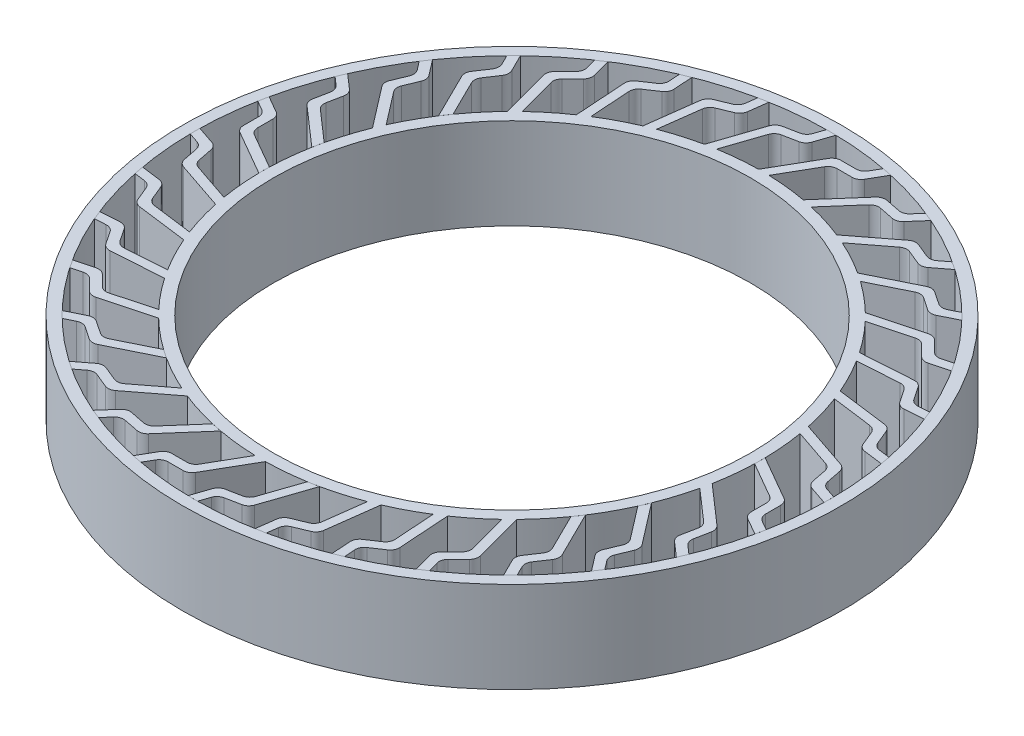
from build123d import *

# Parameters (mm, degrees)
CROQUIS1_R                 = 209.5
SALIENTE_EXTRUIR1_DEPTH    = 80
SALIENTE_EXTRUIR1_2_DEPTH  = 80
SALIENTE_EXTRUIR1_3_DEPTH  = 80
SALIENTE_EXTRUIR1_4_DEPTH  = 80
SALIENTE_EXTRUIR1_5_DEPTH  = 80
SALIENTE_EXTRUIR1_6_DEPTH  = 80
SALIENTE_EXTRUIR1_7_DEPTH  = 80
SALIENTE_EXTRUIR1_8_DEPTH  = 80
SALIENTE_EXTRUIR1_9_DEPTH  = 80
SALIENTE_EXTRUIR1_10_DEPTH = 80
CROQUIS1_R_2               = 289.5
SALIENTE_EXTRUIR1_11_DEPTH = 80


with BuildPart() as part:
    # Croquis1 → Saliente-Extruir1 (new body)
    with BuildSketch(Plane(origin=(0, 0, 0), x_dir=(1, 0, 0), z_dir=(0, 1, 0))):
        with BuildLine():
            Line((19.562792494, 258.450513392), (-2.896488779, 219.480888354))
            ThreePointArc((-2.896488779, 219.480888354), (-19.822178612, 218.60313638), (-36.629689119, 216.422078067))
            Line((-36.629689119, 216.422078067), (-25.139505567, 250.356570456))
            ThreePointArc((-25.139505567, 250.356570456), (-22.839167243, 253.803561656), (-19.122816641, 255.637149107))
            Line((-19.122816641, 255.637149107), (-6.167887823, 258.214044667))
            ThreePointArc((-6.167887823, 258.214044667), (-2.45153722, 260.047632118), (-0.151198896, 263.494623319))
            Line((-0.151198896, 263.494623319), (5.251498634, 279.450660694))
            Line((5.251498634, 279.450660694), (-3.184092463, 279.481862659))
            Line((-3.184092463, 279.481862659), (-6.245988291, 270.439023597))
            ThreePointArc((-6.245988291, 270.439023597), (-8.546326614, 266.992032397), (-12.262677217, 265.158444946))
            Line((-12.262677217, 265.158444946), (-25.217606035, 262.581549386))
            ThreePointArc((-25.217606035, 262.581549386), (-28.933956637, 260.747961935), (-31.234294961, 257.300970734))
            Line((-31.234294961, 257.300970734), (-45.659430745, 214.698547699))
            ThreePointArc((-45.659430745, 214.698547699), (-62.088657278, 210.535623203), (-78.147712816, 205.117490677))
            Line((-78.147712816, 205.117490677), (-73.498600966, 240.641564919))
            ThreePointArc((-73.498600966, 240.641564919), (-71.914937621, 244.471096894), (-68.627710819, 246.994476512))
            Line((-68.627710819, 246.994476512), (-56.424434711, 252.049238982))
            ThreePointArc((-56.424434711, 252.049238982), (-53.137207909, 254.572618599), (-51.553544565, 258.402150575))
            Line((-51.553544565, 258.402150575), (-49.367526822, 275.105611167))
            Line((-49.367526822, 275.105611167), (-57.647117603, 273.490511411))
            Line((-57.647117603, 273.490511411), (-58.886009576, 264.024081724))
            ThreePointArc((-58.886009576, 264.024081724), (-60.469672921, 260.194549748), (-63.756899722, 257.671170131))
            Line((-63.756899722, 257.671170131), (-75.960175831, 252.616407661))
            ThreePointArc((-75.960175831, 252.616407661), (-79.247402632, 250.093028043), (-80.831065977, 246.263496068))
            Line((-80.831065977, 246.263496068), (-86.667706393, 201.66546226))
            ThreePointArc((-86.667706393, 201.66546226), (-101.969103665, 194.377344096), (-116.662563734, 185.930353151))
            Line((-116.662563734, 185.930353151), (-119.033186348, 221.678838996))
            ThreePointArc((-119.033186348, 221.678838996), (-118.227057276, 225.74374498), (-115.495280558, 228.859944701))
            Line((-115.495280558, 228.859944701), (-104.512622216, 236.198322393))
            ThreePointArc((-104.512622216, 236.198322393), (-101.780845498, 239.314522114), (-100.974716427, 243.379428098))
            Line((-100.974716427, 243.379428098), (-102.089385908, 260.188407284))
            Line((-102.089385908, 260.188407284), (-109.894796342, 256.989073186))
            Line((-109.894796342, 256.989073186), (-109.263074538, 247.462842456))
            ThreePointArc((-109.263074538, 247.462842456), (-110.069203609, 243.397936472), (-112.800980327, 240.281736751))
            Line((-112.800980327, 240.281736751), (-123.783638669, 232.943359059))
            ThreePointArc((-123.783638669, 232.943359059), (-126.515415387, 229.827159338), (-127.321544458, 225.762253354))
            Line((-127.321544458, 225.762253354), (-124.345390689, 180.882486202))
            ThreePointArc((-124.345390689, 180.882486202), (-137.930934583, 170.749252664), (-150.694137753, 159.598016425))
            Line((-150.694137753, 159.598016425), (-159.993393133, 194.197119609))
            ThreePointArc((-159.993393133, 194.197119609), (-159.995777423, 198.341187544), (-157.924431436, 201.930453561))
            Line((-157.924431436, 201.930453561), (-148.584448261, 211.270436736))
            ThreePointArc((-148.584448261, 211.270436736), (-146.513102274, 214.859702753), (-146.515486564, 219.003770688))
            Line((-146.515486564, 219.003770688), (-150.888007146, 235.272308824))
            Line((-150.888007146, 235.272308824), (-157.919279688, 230.611688999))
            Line((-157.919279688, 230.611688999), (-155.44122082, 221.391744932))
            ThreePointArc((-155.44122082, 221.391744932), (-155.43883653, 217.247676996), (-157.510182517, 213.658410979))
            Line((-157.510182517, 213.658410979), (-166.850165692, 204.318427805))
            ThreePointArc((-166.850165692, 204.318427805), (-168.921511679, 200.729161788), (-168.919127389, 196.585093852))
            Line((-168.919127389, 196.585093852), (-157.244551354, 153.148297639))
            ThreePointArc((-157.244551354, 153.148297639), (-168.592157037, 140.559363209), (-178.934620569, 127.132417431))
            Line((-178.934620569, 127.132417431), (-184.100892094, 119.528705884))
            ThreePointArc((-184.100892094, 119.528705884), (-192.774477444, 104.967856252), (-200.298746264, 89.781190932))
            Line((-200.298746264, 89.781190932), (-222.13064154, 118.187923239))
            ThreePointArc((-222.13064154, 118.187923239), (-223.718710478, 122.015630358), (-223.178588955, 126.12434956))
            Line((-223.178588955, 126.12434956), (-218.123826486, 138.327625668))
            ThreePointArc((-218.123826486, 138.327625668), (-217.583704962, 142.43634487), (-219.171773901, 146.264051989))
            Line((-219.171773901, 146.264051989), (-229.437156185, 159.620930212))
            Line((-229.437156185, 159.620930212), (-234.149662982, 152.624327436))
            Line((-234.149662982, 152.624327436), (-228.331915272, 145.054521895))
            ThreePointArc((-228.331915272, 145.054521895), (-226.743846333, 141.226814776), (-227.283967857, 137.118095574))
            Line((-227.283967857, 137.118095574), (-232.338730326, 124.914819466))
            ThreePointArc((-232.338730326, 124.914819466), (-232.87885185, 120.806100264), (-231.290782911, 116.978393145))
            Line((-231.290782911, 116.978393145), (-203.882338796, 81.315692995))
            ThreePointArc((-203.882338796, 81.315692995), (-209.548582792, 65.342493446), (-213.965503469, 48.979723615))
            Line((-213.965503469, 48.979723615), (-215.828701556, 39.977763626))
            ThreePointArc((-215.828701556, 39.977763626), (-218.26985362, 23.206055262), (-219.409686368, 6.295992987))
            Line((-219.409686368, 6.295992987), (-219.480888354, -2.896488779))
            ThreePointArc((-219.480888354, -2.896488779), (-218.60313638, -19.822178612), (-216.422078067, -36.629689119))
            Line((-216.422078067, -36.629689119), (-250.356570456, -25.139505567))
            ThreePointArc((-250.356570456, -25.139505567), (-253.803561656, -22.839167243), (-255.637149107, -19.122816641))
            Line((-255.637149107, -19.122816641), (-258.214044667, -6.167887823))
            ThreePointArc((-258.214044667, -6.167887823), (-260.047632118, -2.45153722), (-263.494623319, -0.151198896))
            Line((-263.494623319, -0.151198896), (-279.450660694, 5.251498634))
            Line((-279.450660694, 5.251498634), (-279.481862659, -3.184092463))
            Line((-279.481862659, -3.184092463), (-270.439023597, -6.245988291))
            ThreePointArc((-270.439023597, -6.245988291), (-266.992032397, -8.546326614), (-265.158444946, -12.262677217))
            Line((-265.158444946, -12.262677217), (-262.581549386, -25.217606035))
            ThreePointArc((-262.581549386, -25.217606035), (-260.747961935, -28.933956637), (-257.300970734, -31.234294961))
            Line((-257.300970734, -31.234294961), (-214.698547699, -45.659430745))
            ThreePointArc((-214.698547699, -45.659430745), (-210.535623203, -62.088657278), (-205.117490677, -78.147712816))
            Line((-205.117490677, -78.147712816), (-240.641564919, -73.498600966))
            ThreePointArc((-240.641564919, -73.498600966), (-244.471096894, -71.914937621), (-246.994476512, -68.627710819))
            Line((-246.994476512, -68.627710819), (-252.049238982, -56.424434711))
            ThreePointArc((-252.049238982, -56.424434711), (-254.572618599, -53.137207909), (-258.402150575, -51.553544565))
            Line((-258.402150575, -51.553544565), (-275.105611167, -49.367526822))
            Line((-275.105611167, -49.367526822), (-273.490511411, -57.647117603))
            Line((-273.490511411, -57.647117603), (-264.024081724, -58.886009576))
            ThreePointArc((-264.024081724, -58.886009576), (-260.194549748, -60.469672921), (-257.671170131, -63.756899722))
            Line((-257.671170131, -63.756899722), (-252.616407661, -75.960175831))
            ThreePointArc((-252.616407661, -75.960175831), (-250.093028043, -79.247402632), (-246.263496068, -80.831065977))
            Line((-246.263496068, -80.831065977), (-201.66546226, -86.667706393))
            ThreePointArc((-201.66546226, -86.667706393), (-194.377344096, -101.969103665), (-185.930353151, -116.662563734))
            Line((-185.930353151, -116.662563734), (-221.678838996, -119.033186348))
            ThreePointArc((-221.678838996, -119.033186348), (-225.74374498, -118.227057276), (-228.859944701, -115.495280558))
            Line((-228.859944701, -115.495280558), (-236.198322393, -104.512622216))
            ThreePointArc((-236.198322393, -104.512622216), (-239.314522114, -101.780845498), (-243.379428098, -100.974716427))
            Line((-243.379428098, -100.974716427), (-260.188407284, -102.089385908))
            Line((-260.188407284, -102.089385908), (-256.989073186, -109.894796342))
            Line((-256.989073186, -109.894796342), (-247.462842456, -109.263074538))
            ThreePointArc((-247.462842456, -109.263074538), (-243.397936472, -110.069203609), (-240.281736751, -112.800980327))
            Line((-240.281736751, -112.800980327), (-232.943359059, -123.783638669))
            ThreePointArc((-232.943359059, -123.783638669), (-229.827159338, -126.515415387), (-225.762253354, -127.321544458))
            Line((-225.762253354, -127.321544458), (-180.882486202, -124.345390689))
            ThreePointArc((-180.882486202, -124.345390689), (-170.749252664, -137.930934583), (-159.598016425, -150.694137753))
            Line((-159.598016425, -150.694137753), (-194.197119609, -159.993393133))
            ThreePointArc((-194.197119609, -159.993393133), (-198.341187544, -159.995777423), (-201.930453561, -157.924431436))
            Line((-201.930453561, -157.924431436), (-211.270436736, -148.584448261))
            ThreePointArc((-211.270436736, -148.584448261), (-214.859702753, -146.513102274), (-219.003770688, -146.515486564))
            Line((-219.003770688, -146.515486564), (-235.272308824, -150.888007146))
            Line((-235.272308824, -150.888007146), (-230.611688999, -157.919279688))
            Line((-230.611688999, -157.919279688), (-221.391744932, -155.44122082))
            ThreePointArc((-221.391744932, -155.44122082), (-217.247676996, -155.43883653), (-213.658410979, -157.510182517))
            Line((-213.658410979, -157.510182517), (-204.318427805, -166.850165692))
            ThreePointArc((-204.318427805, -166.850165692), (-200.729161788, -168.921511679), (-196.585093852, -168.919127389))
            Line((-196.585093852, -168.919127389), (-153.148297639, -157.244551354))
            ThreePointArc((-153.148297639, -157.244551354), (-140.559363209, -168.592157037), (-127.132417431, -178.934620569))
            Line((-127.132417431, -178.934620569), (-119.528705884, -184.100892094))
            ThreePointArc((-119.528705884, -184.100892094), (-104.967856252, -192.774477444), (-89.781190932, -200.298746264))
            Line((-89.781190932, -200.298746264), (-118.187923239, -222.13064154))
            ThreePointArc((-118.187923239, -222.13064154), (-122.015630358, -223.718710478), (-126.12434956, -223.178588955))
            Line((-126.12434956, -223.178588955), (-138.327625668, -218.123826486))
            ThreePointArc((-138.327625668, -218.123826486), (-142.43634487, -217.583704962), (-146.264051989, -219.171773901))
            Line((-146.264051989, -219.171773901), (-159.620930212, -229.437156185))
            Line((-159.620930212, -229.437156185), (-152.624327436, -234.149662982))
            Line((-152.624327436, -234.149662982), (-145.054521895, -228.331915272))
            ThreePointArc((-145.054521895, -228.331915272), (-141.226814776, -226.743846333), (-137.118095574, -227.283967857))
            Line((-137.118095574, -227.283967857), (-124.914819466, -232.338730326))
            ThreePointArc((-124.914819466, -232.338730326), (-120.806100264, -232.87885185), (-116.978393145, -231.290782911))
            Line((-116.978393145, -231.290782911), (-81.315692995, -203.882338796))
            ThreePointArc((-81.315692995, -203.882338796), (-65.342493446, -209.548582792), (-48.979723615, -213.965503469))
            Line((-48.979723615, -213.965503469), (-39.977763626, -215.828701556))
            ThreePointArc((-39.977763626, -215.828701556), (-23.206055262, -218.26985362), (-6.295992987, -219.409686368))
            Line((-6.295992987, -219.409686368), (-24.185686933, -250.450513392))
            ThreePointArc((-24.185686933, -250.450513392), (-27.114299524, -253.382497878), (-31.116956658, -254.455829425))
            Line((-31.116956658, -254.455829425), (-44.325687536, -254.455829425))
            ThreePointArc((-44.325687536, -254.455829425), (-48.328344669, -255.529160971), (-51.256957261, -258.461145458))
            Line((-51.256957261, -258.461145458), (-59.668711942, -273.056578048))
            Line((-59.668711942, -273.056578048), (-51.401295565, -274.732882659))
            Line((-51.401295565, -274.732882659), (-46.634062822, -266.461145458))
            ThreePointArc((-46.634062822, -266.461145458), (-43.705450231, -263.529160971), (-39.702793097, -262.455829425))
            Line((-39.702793097, -262.455829425), (-26.494062219, -262.455829425))
            ThreePointArc((-26.494062219, -262.455829425), (-22.491405085, -261.382497878), (-19.562792494, -258.450513392))
            Line((-19.562792494, -258.450513392), (2.896488779, -219.480888354))
            ThreePointArc((2.896488779, -219.480888354), (19.822178612, -218.60313638), (36.629689119, -216.422078067))
            Line((36.629689119, -216.422078067), (45.659430745, -214.698547699))
            ThreePointArc((45.659430745, -214.698547699), (62.088657278, -210.535623203), (78.147712816, -205.117490677))
            Line((78.147712816, -205.117490677), (73.498600966, -240.641564919))
            ThreePointArc((73.498600966, -240.641564919), (71.914937621, -244.471096894), (68.627710819, -246.994476512))
            Line((68.627710819, -246.994476512), (56.424434711, -252.049238982))
            ThreePointArc((56.424434711, -252.049238982), (53.137207909, -254.572618599), (51.553544565, -258.402150575))
            Line((51.553544565, -258.402150575), (49.367526822, -275.105611167))
            Line((49.367526822, -275.105611167), (57.647117603, -273.490511411))
            Line((57.647117603, -273.490511411), (58.886009576, -264.024081724))
            ThreePointArc((58.886009576, -264.024081724), (60.469672921, -260.194549748), (63.756899722, -257.671170131))
            Line((63.756899722, -257.671170131), (75.960175831, -252.616407661))
            ThreePointArc((75.960175831, -252.616407661), (79.247402632, -250.093028043), (80.831065977, -246.263496068))
            Line((80.831065977, -246.263496068), (86.667706393, -201.66546226))
            ThreePointArc((86.667706393, -201.66546226), (101.969103665, -194.377344096), (116.662563734, -185.930353151))
            Line((116.662563734, -185.930353151), (119.033186348, -221.678838996))
            ThreePointArc((119.033186348, -221.678838996), (118.227057276, -225.74374498), (115.495280558, -228.859944701))
            Line((115.495280558, -228.859944701), (104.512622216, -236.198322393))
            ThreePointArc((104.512622216, -236.198322393), (101.780845498, -239.314522114), (100.974716427, -243.379428098))
            Line((100.974716427, -243.379428098), (102.089385908, -260.188407284))
            Line((102.089385908, -260.188407284), (109.894796342, -256.989073186))
            Line((109.894796342, -256.989073186), (109.263074538, -247.462842456))
            ThreePointArc((109.263074538, -247.462842456), (110.069203609, -243.397936472), (112.800980327, -240.281736751))
            Line((112.800980327, -240.281736751), (123.783638669, -232.943359059))
            ThreePointArc((123.783638669, -232.943359059), (126.515415387, -229.827159338), (127.321544458, -225.762253354))
            Line((127.321544458, -225.762253354), (124.345390689, -180.882486202))
            ThreePointArc((124.345390689, -180.882486202), (137.930934583, -170.749252664), (150.694137753, -159.598016425))
            Line((150.694137753, -159.598016425), (159.993393133, -194.197119609))
            ThreePointArc((159.993393133, -194.197119609), (159.995777423, -198.341187544), (157.924431436, -201.930453561))
            Line((157.924431436, -201.930453561), (148.584448261, -211.270436736))
            ThreePointArc((148.584448261, -211.270436736), (146.513102274, -214.859702753), (146.515486564, -219.003770688))
            Line((146.515486564, -219.003770688), (150.888007146, -235.272308824))
            Line((150.888007146, -235.272308824), (157.919279688, -230.611688999))
            Line((157.919279688, -230.611688999), (155.44122082, -221.391744932))
            ThreePointArc((155.44122082, -221.391744932), (155.43883653, -217.247676996), (157.510182517, -213.658410979))
            Line((157.510182517, -213.658410979), (166.850165692, -204.318427805))
            ThreePointArc((166.850165692, -204.318427805), (168.921511679, -200.729161788), (168.919127389, -196.585093852))
            Line((168.919127389, -196.585093852), (157.244551354, -153.148297639))
            ThreePointArc((157.244551354, -153.148297639), (168.592157037, -140.559363209), (178.934620569, -127.132417431))
            Line((178.934620569, -127.132417431), (184.100892094, -119.528705884))
            ThreePointArc((184.100892094, -119.528705884), (192.774477444, -104.967856252), (200.298746264, -89.781190932))
            Line((200.298746264, -89.781190932), (203.882338796, -81.315692995))
            ThreePointArc((203.882338796, -81.315692995), (209.548582792, -65.342493446), (213.965503469, -48.979723615))
            Line((213.965503469, -48.979723615), (240.919783552, -72.581437047))
            ThreePointArc((240.919783552, -72.581437047), (243.224086806, -76.025778966), (243.495914918, -80.160922762))
            Line((243.495914918, -80.160922762), (240.919019358, -93.11585158))
            ThreePointArc((240.919019358, -93.11585158), (241.19084747, -97.250995376), (243.495150723, -100.695337296))
            Line((243.495150723, -100.695337296), (256.169084239, -111.792890114))
            Line((256.169084239, -111.792890114), (259.426072051, -104.01136063))
            Line((259.426072051, -104.01136063), (252.243314931, -97.721993054))
            ThreePointArc((252.243314931, -97.721993054), (249.939011678, -94.277651135), (249.667183565, -90.142507338))
            Line((249.667183565, -90.142507338), (252.244079126, -77.18757852))
            ThreePointArc((252.244079126, -77.18757852), (251.972251013, -73.052434724), (249.66794776, -69.608092805))
            Line((249.66794776, -69.608092805), (215.828701556, -39.977763626))
            ThreePointArc((215.828701556, -39.977763626), (218.26985362, -23.206055262), (219.409686368, -6.295992987))
            Line((219.409686368, -6.295992987), (219.480888354, 2.896488779))
            ThreePointArc((219.480888354, 2.896488779), (218.60313638, 19.822178612), (216.422078067, 36.629689119))
            Line((216.422078067, 36.629689119), (250.356570456, 25.139505567))
            ThreePointArc((250.356570456, 25.139505567), (253.803561656, 22.839167243), (255.637149107, 19.122816641))
            Line((255.637149107, 19.122816641), (258.214044667, 6.167887823))
            ThreePointArc((258.214044667, 6.167887823), (260.047632118, 2.45153722), (263.494623319, 0.151198896))
            Line((263.494623319, 0.151198896), (279.450660694, -5.251498634))
            Line((279.450660694, -5.251498634), (279.481862659, 3.184092463))
            Line((279.481862659, 3.184092463), (270.439023597, 6.245988291))
            ThreePointArc((270.439023597, 6.245988291), (266.992032397, 8.546326614), (265.158444946, 12.262677217))
            Line((265.158444946, 12.262677217), (262.581549386, 25.217606035))
            ThreePointArc((262.581549386, 25.217606035), (260.747961935, 28.933956637), (257.300970734, 31.234294961))
            Line((257.300970734, 31.234294961), (214.698547699, 45.659430745))
            ThreePointArc((214.698547699, 45.659430745), (210.535623203, 62.088657278), (205.117490677, 78.147712816))
            Line((205.117490677, 78.147712816), (240.641564919, 73.498600966))
            ThreePointArc((240.641564919, 73.498600966), (244.471096894, 71.914937621), (246.994476512, 68.627710819))
            Line((246.994476512, 68.627710819), (252.049238982, 56.424434711))
            ThreePointArc((252.049238982, 56.424434711), (254.572618599, 53.137207909), (258.402150575, 51.553544565))
            Line((258.402150575, 51.553544565), (275.105611167, 49.367526822))
            Line((275.105611167, 49.367526822), (273.490511411, 57.647117603))
            Line((273.490511411, 57.647117603), (264.024081724, 58.886009576))
            ThreePointArc((264.024081724, 58.886009576), (260.194549748, 60.469672921), (257.671170131, 63.756899722))
            Line((257.671170131, 63.756899722), (252.616407661, 75.960175831))
            ThreePointArc((252.616407661, 75.960175831), (250.093028043, 79.247402632), (246.263496068, 80.831065977))
            Line((246.263496068, 80.831065977), (201.66546226, 86.667706393))
            ThreePointArc((201.66546226, 86.667706393), (194.377344096, 101.969103665), (185.930353151, 116.662563734))
            Line((185.930353151, 116.662563734), (221.678838996, 119.033186348))
            ThreePointArc((221.678838996, 119.033186348), (225.74374498, 118.227057276), (228.859944701, 115.495280558))
            Line((228.859944701, 115.495280558), (236.198322393, 104.512622216))
            ThreePointArc((236.198322393, 104.512622216), (239.314522114, 101.780845498), (243.379428098, 100.974716427))
            Line((243.379428098, 100.974716427), (260.188407284, 102.089385908))
            Line((260.188407284, 102.089385908), (256.989073186, 109.894796342))
            Line((256.989073186, 109.894796342), (247.462842456, 109.263074538))
            ThreePointArc((247.462842456, 109.263074538), (243.397936472, 110.069203609), (240.281736751, 112.800980327))
            Line((240.281736751, 112.800980327), (232.943359059, 123.783638669))
            ThreePointArc((232.943359059, 123.783638669), (229.827159338, 126.515415387), (225.762253354, 127.321544458))
            Line((225.762253354, 127.321544458), (180.882486202, 124.345390689))
            ThreePointArc((180.882486202, 124.345390689), (170.749252664, 137.930934583), (159.598016425, 150.694137753))
            Line((159.598016425, 150.694137753), (194.197119609, 159.993393133))
            ThreePointArc((194.197119609, 159.993393133), (198.341187544, 159.995777423), (201.930453561, 157.924431436))
            Line((201.930453561, 157.924431436), (211.270436736, 148.584448261))
            ThreePointArc((211.270436736, 148.584448261), (214.859702753, 146.513102274), (219.003770688, 146.515486564))
            Line((219.003770688, 146.515486564), (235.272308824, 150.888007146))
            Line((235.272308824, 150.888007146), (230.611688999, 157.919279688))
            Line((230.611688999, 157.919279688), (221.391744932, 155.44122082))
            ThreePointArc((221.391744932, 155.44122082), (217.247676996, 155.43883653), (213.658410979, 157.510182517))
            Line((213.658410979, 157.510182517), (204.318427805, 166.850165692))
            ThreePointArc((204.318427805, 166.850165692), (200.729161788, 168.921511679), (196.585093852, 168.919127389))
            Line((196.585093852, 168.919127389), (153.148297639, 157.244551354))
            ThreePointArc((153.148297639, 157.244551354), (140.559363209, 168.592157037), (127.132417431, 178.934620569))
            Line((127.132417431, 178.934620569), (159.252513822, 194.805143546))
            ThreePointArc((159.252513822, 194.805143546), (163.316489502, 195.615949571), (167.240888335, 194.284634979))
            Line((167.240888335, 194.284634979), (178.223546677, 186.946257287))
            ThreePointArc((178.223546677, 186.946257287), (182.147945509, 185.614942695), (186.21192119, 186.42574872))
            Line((186.21192119, 186.42574872), (201.314827479, 193.888086888))
            Line((201.314827479, 193.888086888), (195.372026932, 199.875013677))
            Line((195.372026932, 199.875013677), (186.812686808, 195.645848158))
            ThreePointArc((186.812686808, 195.645848158), (182.748711127, 194.835042134), (178.824312295, 196.166356726))
            Line((178.824312295, 196.166356726), (167.841653953, 203.504734417))
            ThreePointArc((167.841653953, 203.504734417), (163.91725512, 204.836049009), (159.85327944, 204.025242985))
            Line((159.85327944, 204.025242985), (119.528705884, 184.100892094))
            ThreePointArc((119.528705884, 184.100892094), (104.967856252, 192.774477444), (89.781190932, 200.298746264))
            Line((89.781190932, 200.298746264), (118.187923239, 222.13064154))
            ThreePointArc((118.187923239, 222.13064154), (122.015630358, 223.718710478), (126.12434956, 223.178588955))
            Line((126.12434956, 223.178588955), (138.327625668, 218.123826486))
            ThreePointArc((138.327625668, 218.123826486), (142.43634487, 217.583704962), (146.264051989, 219.171773901))
            Line((146.264051989, 219.171773901), (159.620930212, 229.437156185))
            Line((159.620930212, 229.437156185), (152.624327436, 234.149662982))
            Line((152.624327436, 234.149662982), (145.054521895, 228.331915272))
            ThreePointArc((145.054521895, 228.331915272), (141.226814776, 226.743846333), (137.118095574, 227.283967857))
            Line((137.118095574, 227.283967857), (124.914819466, 232.338730326))
            ThreePointArc((124.914819466, 232.338730326), (120.806100264, 232.87885185), (116.978393145, 231.290782911))
            Line((116.978393145, 231.290782911), (81.315692995, 203.882338796))
            ThreePointArc((81.315692995, 203.882338796), (65.342493446, 209.548582792), (48.979723615, 213.965503469))
            Line((48.979723615, 213.965503469), (72.581437047, 240.919783552))
            ThreePointArc((72.581437047, 240.919783552), (76.025778966, 243.224086806), (80.160922762, 243.495914918))
            Line((80.160922762, 243.495914918), (93.11585158, 240.919019358))
            ThreePointArc((93.11585158, 240.919019358), (97.250995376, 241.19084747), (100.695337296, 243.495150723))
            Line((100.695337296, 243.495150723), (111.792890114, 256.169084239))
            Line((111.792890114, 256.169084239), (104.01136063, 259.426072051))
            Line((104.01136063, 259.426072051), (97.721993054, 252.243314931))
            ThreePointArc((97.721993054, 252.243314931), (94.277651135, 249.939011678), (90.142507338, 249.667183565))
            Line((90.142507338, 249.667183565), (77.18757852, 252.244079126))
            ThreePointArc((77.18757852, 252.244079126), (73.052434724, 251.972251013), (69.608092805, 249.66794776))
            Line((69.608092805, 249.66794776), (39.977763626, 215.828701556))
            ThreePointArc((39.977763626, 215.828701556), (23.206055262, 218.26985362), (6.295992987, 219.409686368))
            Line((6.295992987, 219.409686368), (24.185686933, 250.450513392))
            ThreePointArc((24.185686933, 250.450513392), (27.114299524, 253.382497878), (31.116956658, 254.455829425))
            Line((31.116956658, 254.455829425), (44.325687536, 254.455829425))
            ThreePointArc((44.325687536, 254.455829425), (48.328344669, 255.529160971), (51.256957261, 258.461145458))
            Line((51.256957261, 258.461145458), (59.668711942, 273.056578048))
            Line((59.668711942, 273.056578048), (51.401295565, 274.732882659))
            Line((51.401295565, 274.732882659), (46.634062822, 266.461145458))
            ThreePointArc((46.634062822, 266.461145458), (43.705450231, 263.529160971), (39.702793097, 262.455829425))
            Line((39.702793097, 262.455829425), (26.494062219, 262.455829425))
            ThreePointArc((26.494062219, 262.455829425), (22.491405085, 261.382497878), (19.562792494, 258.450513392))
        make_face()
        Circle(CROQUIS1_R, mode=Mode.SUBTRACT)
    extrude(amount=SALIENTE_EXTRUIR1_DEPTH)


with BuildPart() as body_2:
    # Croquis1 → Saliente-Extruir1 2 (new body)
    with BuildSketch(Plane(origin=(0, 0, 0), x_dir=(1, 0, 0), z_dir=(0, 1, 0))):
        with BuildLine():
            ThreePointArc((-184.100892094, 119.528705884), (-181.557566548, 123.357610341), (-178.934620569, 127.132417431))
            Line((-178.934620569, 127.132417431), (-194.805143546, 159.252513822))
            ThreePointArc((-194.805143546, 159.252513822), (-195.615949571, 163.316489502), (-194.284634979, 167.240888335))
            Line((-194.284634979, 167.240888335), (-186.946257287, 178.223546677))
            ThreePointArc((-186.946257287, 178.223546677), (-185.614942695, 182.147945509), (-186.42574872, 186.21192119))
            Line((-186.42574872, 186.21192119), (-193.888086888, 201.314827479))
            Line((-193.888086888, 201.314827479), (-199.875013677, 195.372026932))
            Line((-199.875013677, 195.372026932), (-195.645848158, 186.812686808))
            ThreePointArc((-195.645848158, 186.812686808), (-194.835042134, 182.748711127), (-196.166356726, 178.824312295))
            Line((-196.166356726, 178.824312295), (-203.504734417, 167.841653953))
            ThreePointArc((-203.504734417, 167.841653953), (-204.836049009, 163.91725512), (-204.025242985, 159.85327944))
            Line((-204.025242985, 159.85327944), (-184.100892094, 119.528705884))
        make_face()
    extrude(amount=SALIENTE_EXTRUIR1_2_DEPTH)


with BuildPart() as body_3:
    # Croquis1 → Saliente-Extruir1 3 (new body)
    with BuildSketch(Plane(origin=(0, 0, 0), x_dir=(1, 0, 0), z_dir=(0, 1, 0))):
        with BuildLine():
            ThreePointArc((-215.828701556, 39.977763626), (-214.94423344, 44.488498635), (-213.965503469, 48.979723615))
            Line((-213.965503469, 48.979723615), (-240.919783552, 72.581437047))
            ThreePointArc((-240.919783552, 72.581437047), (-243.224086806, 76.025778966), (-243.495914918, 80.160922762))
            Line((-243.495914918, 80.160922762), (-240.919019358, 93.11585158))
            ThreePointArc((-240.919019358, 93.11585158), (-241.19084747, 97.250995376), (-243.495150723, 100.695337296))
            Line((-243.495150723, 100.695337296), (-256.169084239, 111.792890114))
            Line((-256.169084239, 111.792890114), (-259.426072051, 104.01136063))
            Line((-259.426072051, 104.01136063), (-252.243314931, 97.721993054))
            ThreePointArc((-252.243314931, 97.721993054), (-249.939011678, 94.277651135), (-249.667183565, 90.142507338))
            Line((-249.667183565, 90.142507338), (-252.244079126, 77.18757852))
            ThreePointArc((-252.244079126, 77.18757852), (-251.972251013, 73.052434724), (-249.66794776, 69.608092805))
            Line((-249.66794776, 69.608092805), (-215.828701556, 39.977763626))
        make_face()
    extrude(amount=SALIENTE_EXTRUIR1_3_DEPTH)


with BuildPart() as body_4:
    # Croquis1 → Saliente-Extruir1 4 (new body)
    with BuildSketch(Plane(origin=(0, 0, 0), x_dir=(1, 0, 0), z_dir=(0, 1, 0))):
        with BuildLine():
            ThreePointArc((-219.480888354, -2.896488779), (-219.49341579, 1.700124891), (-219.409686368, 6.295992987))
            Line((-219.409686368, 6.295992987), (-250.450513392, 24.185686933))
            ThreePointArc((-250.450513392, 24.185686933), (-253.382497878, 27.114299524), (-254.455829425, 31.116956658))
            Line((-254.455829425, 31.116956658), (-254.455829425, 44.325687536))
            ThreePointArc((-254.455829425, 44.325687536), (-255.529160971, 48.328344669), (-258.461145458, 51.256957261))
            Line((-258.461145458, 51.256957261), (-273.056578048, 59.668711942))
            Line((-273.056578048, 59.668711942), (-274.732882659, 51.401295565))
            Line((-274.732882659, 51.401295565), (-266.461145458, 46.634062822))
            ThreePointArc((-266.461145458, 46.634062822), (-263.529160971, 43.705450231), (-262.455829425, 39.702793097))
            Line((-262.455829425, 39.702793097), (-262.455829425, 26.494062219))
            ThreePointArc((-262.455829425, 26.494062219), (-261.382497878, 22.491405085), (-258.450513392, 19.562792494))
            Line((-258.450513392, 19.562792494), (-219.480888354, -2.896488779))
        make_face()
    extrude(amount=SALIENTE_EXTRUIR1_4_DEPTH)


with BuildPart() as body_5:
    # Croquis1 → Saliente-Extruir1 5 (new body)
    with BuildSketch(Plane(origin=(0, 0, 0), x_dir=(1, 0, 0), z_dir=(0, 1, 0))):
        with BuildLine():
            Line((258.450513392, -19.562792494), (219.480888354, 2.896488779))
            ThreePointArc((219.480888354, 2.896488779), (219.49341579, -1.700124891), (219.409686368, -6.295992987))
            Line((219.409686368, -6.295992987), (250.450513392, -24.185686933))
            ThreePointArc((250.450513392, -24.185686933), (253.382497878, -27.114299524), (254.455829425, -31.116956658))
            Line((254.455829425, -31.116956658), (254.455829425, -44.325687536))
            ThreePointArc((254.455829425, -44.325687536), (255.529160971, -48.328344669), (258.461145458, -51.256957261))
            Line((258.461145458, -51.256957261), (273.056578048, -59.668711942))
            Line((273.056578048, -59.668711942), (274.732882659, -51.401295565))
            Line((274.732882659, -51.401295565), (266.461145458, -46.634062822))
            ThreePointArc((266.461145458, -46.634062822), (263.529160971, -43.705450231), (262.455829425, -39.702793097))
            Line((262.455829425, -39.702793097), (262.455829425, -26.494062219))
            ThreePointArc((262.455829425, -26.494062219), (261.382497878, -22.491405085), (258.450513392, -19.562792494))
        make_face()
    extrude(amount=SALIENTE_EXTRUIR1_5_DEPTH)


with BuildPart() as body_6:
    # Croquis1 → Saliente-Extruir1 6 (new body)
    with BuildSketch(Plane(origin=(0, 0, 0), x_dir=(1, 0, 0), z_dir=(0, 1, 0))):
        with BuildLine():
            Line((231.290782911, -116.978393145), (203.882338796, -81.315692995))
            ThreePointArc((203.882338796, -81.315692995), (202.134864741, -85.567204326), (200.298746264, -89.781190932))
            Line((200.298746264, -89.781190932), (222.13064154, -118.187923239))
            ThreePointArc((222.13064154, -118.187923239), (223.718710479, -122.015630358), (223.178588955, -126.12434956))
            Line((223.178588955, -126.12434956), (218.123826486, -138.327625668))
            ThreePointArc((218.123826486, -138.327625668), (217.583704962, -142.43634487), (219.171773901, -146.264051989))
            Line((219.171773901, -146.264051989), (229.437156185, -159.620930212))
            Line((229.437156185, -159.620930212), (234.149662982, -152.624327436))
            Line((234.149662982, -152.624327436), (228.331915272, -145.054521895))
            ThreePointArc((228.331915272, -145.054521895), (226.743846333, -141.226814776), (227.283967857, -137.118095574))
            Line((227.283967857, -137.118095574), (232.338730326, -124.914819466))
            ThreePointArc((232.338730326, -124.914819466), (232.87885185, -120.806100264), (231.290782911, -116.978393145))
        make_face()
    extrude(amount=SALIENTE_EXTRUIR1_6_DEPTH)


with BuildPart() as body_7:
    # Croquis1 → Saliente-Extruir1 7 (new body)
    with BuildSketch(Plane(origin=(0, 0, 0), x_dir=(1, 0, 0), z_dir=(0, 1, 0))):
        with BuildLine():
            Line((204.025242985, -159.85327944), (184.100892094, -119.528705884))
            ThreePointArc((184.100892094, -119.528705884), (181.557566548, -123.357610341), (178.934620569, -127.132417431))
            Line((178.934620569, -127.132417431), (194.805143546, -159.252513822))
            ThreePointArc((194.805143546, -159.252513822), (195.615949571, -163.316489502), (194.284634979, -167.240888335))
            Line((194.284634979, -167.240888335), (186.946257287, -178.223546677))
            ThreePointArc((186.946257287, -178.223546677), (185.614942695, -182.147945509), (186.42574872, -186.21192119))
            Line((186.42574872, -186.21192119), (193.888086888, -201.314827479))
            Line((193.888086888, -201.314827479), (199.875013677, -195.372026932))
            Line((199.875013677, -195.372026932), (195.645848158, -186.812686808))
            ThreePointArc((195.645848158, -186.812686808), (194.835042134, -182.748711127), (196.166356726, -178.824312295))
            Line((196.166356726, -178.824312295), (203.504734417, -167.841653953))
            ThreePointArc((203.504734417, -167.841653953), (204.836049009, -163.91725512), (204.025242985, -159.85327944))
        make_face()
    extrude(amount=SALIENTE_EXTRUIR1_7_DEPTH)


with BuildPart() as body_8:
    # Croquis1 → Saliente-Extruir1 8 (new body)
    with BuildSketch(Plane(origin=(0, 0, 0), x_dir=(1, 0, 0), z_dir=(0, 1, 0))):
        with BuildLine():
            ThreePointArc((-119.528705884, -184.100892094), (-123.357610341, -181.557566548), (-127.132417431, -178.934620569))
            Line((-127.132417431, -178.934620569), (-159.252513822, -194.805143546))
            ThreePointArc((-159.252513822, -194.805143546), (-163.316489502, -195.615949571), (-167.240888335, -194.284634979))
            Line((-167.240888335, -194.284634979), (-178.223546677, -186.946257287))
            ThreePointArc((-178.223546677, -186.946257287), (-182.147945509, -185.614942695), (-186.21192119, -186.42574872))
            Line((-186.21192119, -186.42574872), (-201.314827479, -193.888086888))
            Line((-201.314827479, -193.888086888), (-195.372026932, -199.875013677))
            Line((-195.372026932, -199.875013677), (-186.812686808, -195.645848158))
            ThreePointArc((-186.812686808, -195.645848158), (-182.748711127, -194.835042134), (-178.824312295, -196.166356726))
            Line((-178.824312295, -196.166356726), (-167.841653953, -203.504734417))
            ThreePointArc((-167.841653953, -203.504734417), (-163.91725512, -204.836049009), (-159.85327944, -204.025242985))
            Line((-159.85327944, -204.025242985), (-119.528705884, -184.100892094))
        make_face()
    extrude(amount=SALIENTE_EXTRUIR1_8_DEPTH)


with BuildPart() as body_9:
    # Croquis1 → Saliente-Extruir1 9 (new body)
    with BuildSketch(Plane(origin=(0, 0, 0), x_dir=(1, 0, 0), z_dir=(0, 1, 0))):
        with BuildLine():
            ThreePointArc((-39.977763626, -215.828701556), (-44.488498635, -214.94423344), (-48.979723615, -213.965503469))
            Line((-48.979723615, -213.965503469), (-72.581437047, -240.919783552))
            ThreePointArc((-72.581437047, -240.919783552), (-76.025778966, -243.224086806), (-80.160922762, -243.495914918))
            Line((-80.160922762, -243.495914918), (-93.11585158, -240.919019358))
            ThreePointArc((-93.11585158, -240.919019358), (-97.250995376, -241.19084747), (-100.695337296, -243.495150723))
            Line((-100.695337296, -243.495150723), (-111.792890114, -256.169084239))
            Line((-111.792890114, -256.169084239), (-104.01136063, -259.426072051))
            Line((-104.01136063, -259.426072051), (-97.721993054, -252.243314931))
            ThreePointArc((-97.721993054, -252.243314931), (-94.277651135, -249.939011678), (-90.142507338, -249.667183565))
            Line((-90.142507338, -249.667183565), (-77.18757852, -252.244079126))
            ThreePointArc((-77.18757852, -252.244079126), (-73.052434724, -251.972251013), (-69.608092805, -249.66794776))
            Line((-69.608092805, -249.66794776), (-39.977763626, -215.828701556))
        make_face()
    extrude(amount=SALIENTE_EXTRUIR1_9_DEPTH)


with BuildPart() as body_10:
    # Croquis1 → Saliente-Extruir1 10 (new body)
    with BuildSketch(Plane(origin=(0, 0, 0), x_dir=(1, 0, 0), z_dir=(0, 1, 0))):
        with BuildLine():
            Line((31.234294961, -257.300970734), (45.659430745, -214.698547699))
            ThreePointArc((45.659430745, -214.698547699), (41.153583699, -215.607589265), (36.629689119, -216.422078067))
            Line((36.629689119, -216.422078067), (25.139505567, -250.356570456))
            ThreePointArc((25.139505567, -250.356570456), (22.839167243, -253.803561656), (19.122816641, -255.637149107))
            Line((19.122816641, -255.637149107), (6.167887823, -258.214044667))
            ThreePointArc((6.167887823, -258.214044667), (2.45153722, -260.047632118), (0.151198896, -263.494623319))
            Line((0.151198896, -263.494623319), (-5.251498634, -279.450660694))
            Line((-5.251498634, -279.450660694), (3.184092463, -279.481862659))
            Line((3.184092463, -279.481862659), (6.245988291, -270.439023597))
            ThreePointArc((6.245988291, -270.439023597), (8.546326614, -266.992032397), (12.262677217, -265.158444946))
            Line((12.262677217, -265.158444946), (25.217606035, -262.581549386))
            ThreePointArc((25.217606035, -262.581549386), (28.933956637, -260.747961935), (31.234294961, -257.300970734))
        make_face()
    extrude(amount=SALIENTE_EXTRUIR1_10_DEPTH)


with BuildPart() as body_11:
    # Croquis1 → Saliente-Extruir1 11 (new body)
    with BuildSketch(Plane(origin=(0, 0, 0), x_dir=(1, 0, 0), z_dir=(0, 1, 0))):
        Circle(CROQUIS1_R_2)
        with BuildLine():
            ThreePointArc((5.251498634, 279.450660694), (28.424445993, 278.050896186), (51.401295565, 274.732882659))
            ThreePointArc((51.401295565, 274.732882659), (55.541328227, 273.92592221), (59.668711942, 273.056578048))
            ThreePointArc((59.668711942, 273.056578048), (82.123317108, 267.16289186), (104.01136063, 259.426072051))
            ThreePointArc((104.01136063, 259.426072051), (107.914413551, 257.826936816), (111.792890114, 256.169084239))
            ThreePointArc((111.792890114, 256.169084239), (132.666235201, 246.007967427), (152.624327436, 234.149662982))
            ThreePointArc((152.624327436, 234.149662982), (156.140408482, 231.819806831), (159.620930212, 229.437156185))
            ThreePointArc((159.620930212, 229.437156185), (178.110864275, 215.399094769), (195.372026932, 199.875013677))
            ThreePointArc((195.372026932, 199.875013677), (198.36601508, 196.903971675), (201.314827479, 193.888086888))
            ThreePointArc((201.314827479, 193.888086888), (216.710792722, 176.512555695), (230.611688999, 157.919279688))
            ThreePointArc((230.611688999, 157.919279688), (232.968526963, 154.421227313), (235.272308824, 150.888007146))
            ThreePointArc((235.272308824, 150.888007146), (246.982646936, 130.842738096), (256.989073186, 109.894796342))
            ThreePointArc((256.989073186, 109.894796342), (258.618189005, 106.004161785), (260.188407284, 102.089385908))
            ThreePointArc((260.188407284, 102.089385908), (267.763096539, 80.144707449), (273.490511411, 57.647117603))
            ThreePointArc((273.490511411, 57.647117603), (274.329299078, 53.513415768), (275.105611167, 49.367526822))
            ThreePointArc((275.105611167, 49.367526822), (278.253560504, 26.36676064), (279.481862659, 3.184092463))
            ThreePointArc((279.481862659, 3.184092463), (279.498088034, -1.033820806), (279.450660694, -5.251498634))
            ThreePointArc((279.450660694, -5.251498634), (278.050896186, -28.424445993), (274.732882659, -51.401295565))
            ThreePointArc((274.732882659, -51.401295565), (273.92592221, -55.541328227), (273.056578048, -59.668711942))
            ThreePointArc((273.056578048, -59.668711942), (267.16289186, -82.123317108), (259.426072051, -104.01136063))
            ThreePointArc((259.426072051, -104.01136063), (257.826936816, -107.914413551), (256.169084239, -111.792890114))
            ThreePointArc((256.169084239, -111.792890114), (246.007967427, -132.666235201), (234.149662982, -152.624327436))
            ThreePointArc((234.149662982, -152.624327436), (231.819806831, -156.140408482), (229.437156185, -159.620930212))
            ThreePointArc((229.437156185, -159.620930212), (215.399094769, -178.110864275), (199.875013677, -195.372026932))
            ThreePointArc((199.875013677, -195.372026932), (196.903971675, -198.36601508), (193.888086888, -201.314827479))
            ThreePointArc((193.888086888, -201.314827479), (176.512555695, -216.710792722), (157.919279688, -230.611688999))
            ThreePointArc((157.919279688, -230.611688999), (154.421227313, -232.968526963), (150.888007146, -235.272308824))
            ThreePointArc((150.888007146, -235.272308824), (130.842738096, -246.982646936), (109.894796342, -256.989073186))
            ThreePointArc((109.894796342, -256.989073186), (106.004161785, -258.618189005), (102.089385908, -260.188407284))
            ThreePointArc((102.089385908, -260.188407284), (80.144707449, -267.763096539), (57.647117603, -273.490511411))
            ThreePointArc((57.647117603, -273.490511411), (53.513415768, -274.329299078), (49.367526822, -275.105611167))
            ThreePointArc((49.367526822, -275.105611167), (26.36676064, -278.253560504), (3.184092463, -279.481862659))
            ThreePointArc((3.184092463, -279.481862659), (-1.033820806, -279.498088034), (-5.251498634, -279.450660694))
            ThreePointArc((-5.251498634, -279.450660694), (-28.424445993, -278.050896186), (-51.401295565, -274.732882659))
            ThreePointArc((-51.401295565, -274.732882659), (-55.541328227, -273.92592221), (-59.668711942, -273.056578048))
            ThreePointArc((-59.668711942, -273.056578048), (-82.123317108, -267.16289186), (-104.01136063, -259.426072051))
            ThreePointArc((-104.01136063, -259.426072051), (-107.914413551, -257.826936816), (-111.792890114, -256.169084239))
            ThreePointArc((-111.792890114, -256.169084239), (-132.666235201, -246.007967427), (-152.624327436, -234.149662982))
            ThreePointArc((-152.624327436, -234.149662982), (-156.140408482, -231.819806831), (-159.620930212, -229.437156185))
            ThreePointArc((-159.620930212, -229.437156185), (-178.110864275, -215.399094769), (-195.372026932, -199.875013677))
            ThreePointArc((-195.372026932, -199.875013677), (-198.36601508, -196.903971675), (-201.314827479, -193.888086888))
            ThreePointArc((-201.314827479, -193.888086888), (-216.710792722, -176.512555695), (-230.611688999, -157.919279688))
            ThreePointArc((-230.611688999, -157.919279688), (-232.968526963, -154.421227313), (-235.272308824, -150.888007146))
            ThreePointArc((-235.272308824, -150.888007146), (-246.982646936, -130.842738096), (-256.989073186, -109.894796342))
            ThreePointArc((-256.989073186, -109.894796342), (-258.618189005, -106.004161785), (-260.188407284, -102.089385908))
            ThreePointArc((-260.188407284, -102.089385908), (-267.763096539, -80.144707449), (-273.490511411, -57.647117603))
            ThreePointArc((-273.490511411, -57.647117603), (-274.329299078, -53.513415768), (-275.105611167, -49.367526822))
            ThreePointArc((-275.105611167, -49.367526822), (-278.253560504, -26.36676064), (-279.481862659, -3.184092463))
            ThreePointArc((-279.481862659, -3.184092463), (-279.498088034, 1.033820806), (-279.450660694, 5.251498634))
            ThreePointArc((-279.450660694, 5.251498634), (-278.050896186, 28.424445993), (-274.732882659, 51.401295565))
            ThreePointArc((-274.732882659, 51.401295565), (-273.92592221, 55.541328227), (-273.056578048, 59.668711942))
            ThreePointArc((-273.056578048, 59.668711942), (-267.16289186, 82.123317108), (-259.426072051, 104.01136063))
            ThreePointArc((-259.426072051, 104.01136063), (-257.826936816, 107.914413551), (-256.169084239, 111.792890114))
            ThreePointArc((-256.169084239, 111.792890114), (-246.007967427, 132.666235201), (-234.149662982, 152.624327436))
            ThreePointArc((-234.149662982, 152.624327436), (-231.819806831, 156.140408482), (-229.437156185, 159.620930212))
            ThreePointArc((-229.437156185, 159.620930212), (-215.399094769, 178.110864275), (-199.875013677, 195.372026932))
            ThreePointArc((-199.875013677, 195.372026932), (-196.903971675, 198.36601508), (-193.888086888, 201.314827479))
            ThreePointArc((-193.888086888, 201.314827479), (-176.512555695, 216.710792722), (-157.919279688, 230.611688999))
            ThreePointArc((-157.919279688, 230.611688999), (-154.421227313, 232.968526963), (-150.888007146, 235.272308824))
            ThreePointArc((-150.888007146, 235.272308824), (-130.842738096, 246.982646936), (-109.894796342, 256.989073186))
            ThreePointArc((-109.894796342, 256.989073186), (-106.004161785, 258.618189005), (-102.089385908, 260.188407284))
            ThreePointArc((-102.089385908, 260.188407284), (-80.144707449, 267.763096539), (-57.647117603, 273.490511411))
            ThreePointArc((-57.647117603, 273.490511411), (-53.513415768, 274.329299078), (-49.367526822, 275.105611167))
            ThreePointArc((-49.367526822, 275.105611167), (-26.36676064, 278.253560504), (-3.184092463, 279.481862659))
            ThreePointArc((-3.184092463, 279.481862659), (1.033820806, 279.498088034), (5.251498634, 279.450660694))
        make_face(mode=Mode.SUBTRACT)
    extrude(amount=SALIENTE_EXTRUIR1_11_DEPTH)


solid = Compound([part.part, body_2.part, body_3.part, body_4.part, body_5.part, body_6.part, body_7.part, body_8.part, body_9.part, body_10.part, body_11.part])
